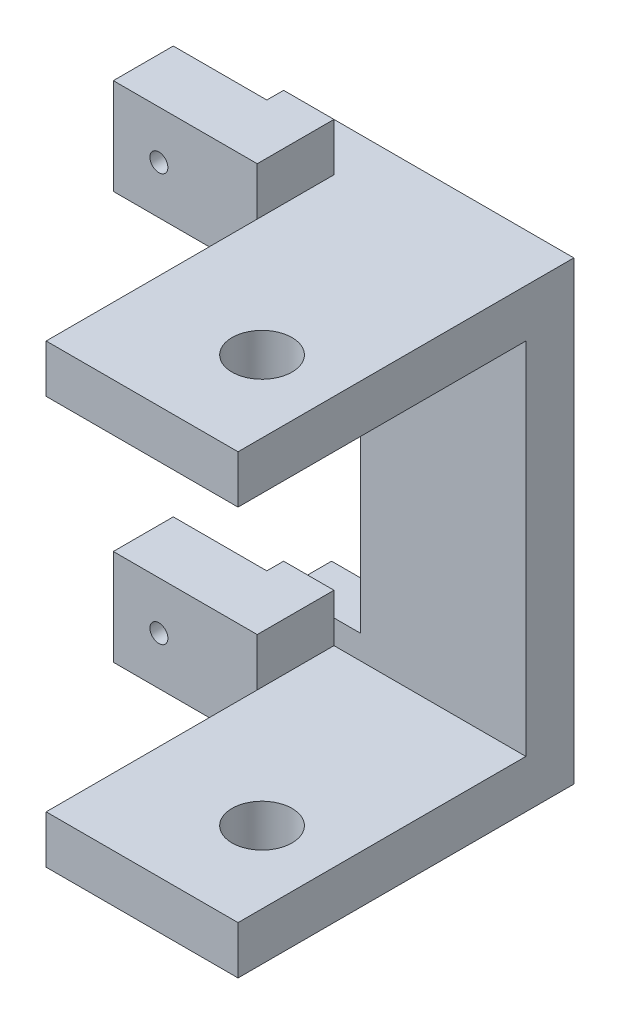
from build123d import *

# Parameters (mm, degrees)
EXTRUDE_1_DEPTH     = 2
SKETCH_3_W          = 8
SKETCH_3_H          = 2
EXTRUDE_2_DEPTH     = 12
SKETCH_10_W         = 6
SKETCH_10_H         = 4
EXTRUDE_4_DEPTH     = 3.2
CUT_EXTRUDE_2_REACH = 23.448
CUT_EXTRUDE_START   = 3.2
SKETCH_9_R          = 0.375
SKETCH_11_R         = 1.25
CUT_EXTRUDE_3_DEPTH = 27.446360808
SKETCH_12_W         = 3.9
SKETCH_12_H         = 2.7
CUT_EXTRUDE_4_DEPTH = 27.446360808


with BuildPart() as part:
    # 草图2 → 凸台-拉伸1 (new body)
    with BuildSketch(Plane.XY):
        Polygon((-5.9, -9.75), (6.1, -9.75), (6.1, 9.25), (-5.9, 9.25), (-5.9, 6.75), (-0.8, 6.75), (-0.8, -6.75), (-5.9, -6.75), align=None)
    extrude(amount=EXTRUDE_1_DEPTH)

    # 草图3 → 凸台-拉伸2 (add)
    with BuildSketch(Plane.XY.offset(2)):
        with Locations((2.1, 8.25)):
            Rectangle(SKETCH_3_W, SKETCH_3_H)
        with Locations((2.1, -8.75)):
            Rectangle(SKETCH_3_W, SKETCH_3_H)
    extrude(amount=EXTRUDE_2_DEPTH)

    # 草图10 → 凸台-拉伸4 (add)
    with BuildSketch(Plane.XY.offset(2)):
        with Locations((-4.9, 9.25)):
            Rectangle(SKETCH_10_W, SKETCH_10_H)
        with Locations((-4.9, -7.75)):
            Rectangle(SKETCH_10_W, SKETCH_10_H)
    extrude(amount=EXTRUDE_4_DEPTH)

    # 草图9 → 切除-拉伸2 (cut, up to next)
    with BuildSketch(Plane.XY.offset(2).offset(CUT_EXTRUDE_START), mode=Mode.PRIVATE) as cut_extrude_2_sk1:
        with Locations((-6, 9.25)):
            Circle(SKETCH_9_R)
    cut_extrude_2_tool1 = extrude(cut_extrude_2_sk1.sketch, amount=-CUT_EXTRUDE_2_REACH, mode=Mode.PRIVATE) & part.part
    # 草图9 → 切除-拉伸2 (cut, up to next)
    with BuildSketch(Plane.XY.offset(2).offset(CUT_EXTRUDE_START), mode=Mode.PRIVATE) as cut_extrude_2_sk2:
        with Locations((-6, -7.75)):
            Circle(SKETCH_9_R)
    cut_extrude_2_tool2 = extrude(cut_extrude_2_sk2.sketch, amount=-CUT_EXTRUDE_2_REACH, mode=Mode.PRIVATE) & part.part
    add(cut_extrude_2_tool1.solids().sort_by_distance((-6, 9.25, 5.2))[0], mode=Mode.SUBTRACT)
    add(cut_extrude_2_tool2.solids().sort_by_distance((-6, -7.75, 5.2))[0], mode=Mode.SUBTRACT)

    # 草图11 → 切除-拉伸3 (cut, through all)
    with BuildSketch(Plane.XZ.offset(9.75)):
        with Locations((3.1, 10)):
            Circle(SKETCH_11_R)
    extrude(amount=-CUT_EXTRUDE_3_DEPTH, mode=Mode.SUBTRACT)

    # 草图12 → 切除-拉伸4 (cut, through all)
    with BuildSketch(Plane.XZ.offset(9.75)):
        with Locations((-5.95, 1.35)):
            Rectangle(SKETCH_12_W, SKETCH_12_H)
    extrude(amount=-CUT_EXTRUDE_4_DEPTH, mode=Mode.SUBTRACT)


solid = part.part
